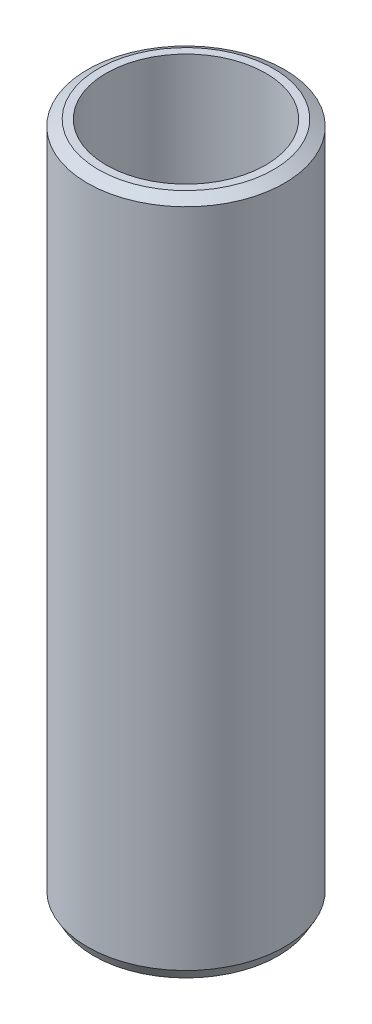
from build123d import *
from OCP.BRepFilletAPI import BRepFilletAPI_MakeChamfer

# Parameters (mm, degrees)
SKETCH1_R           = 57.5
BOSS_EXTRUDE1_DEPTH = 396.211039372
SKETCH2_R           = 46.540156531
CUT_EXTRUDE1_DEPTH  = 405.469637575
CHAMFER1_SIZE       = 3.674795118
CHAMFER1_SIZE2      = 6.364931852


with BuildPart() as part:
    # Sketch1 → Boss-Extrude1 (new body)
    with BuildSketch(Plane(origin=(0, 0, 0), x_dir=(1, 0, 0), z_dir=(0, 1, 0))):
        Circle(SKETCH1_R)
    extrude(amount=BOSS_EXTRUDE1_DEPTH)

    # Sketch2 → Cut-Extrude1 (cut, through all)
    with BuildSketch(Plane(origin=(0, 0, 0), x_dir=(1, 0, 0), z_dir=(0, 1, 0))):
        Circle(SKETCH2_R)
    extrude(amount=CUT_EXTRUDE1_DEPTH, mode=Mode.SUBTRACT)

    # Chamfer1: one chamfer whose edges measure the first distance from different faces: ONE call of the kernel's chamfer builder (chamfer() names one face for all edges)
    chamfer1_edges_1 = [part.edges().sort_by_distance(p)[0] for p in [
        (-57.5, 396.211039372, 0),
    ]]
    chamfer1_side_1 = [part.faces().sort_by_distance(p)[0] for p in [
        (-57.5, 198.105519686, 0),
    ]]
    chamfer1_edges_2 = [part.edges().sort_by_distance(p)[0] for p in [
        (-57.5, 0, 0),
    ]]
    chamfer1_side_2 = [part.faces().sort_by_distance(p)[0] for p in [
        (-55.873654403, 0, 0),
    ]]
    chamfer1 = BRepFilletAPI_MakeChamfer(part.part.solid().wrapped)
    for e in chamfer1_edges_1:
        chamfer1.Add(CHAMFER1_SIZE, CHAMFER1_SIZE2, e.wrapped, chamfer1_side_1[0].wrapped)  # the first distance lies on this face
    for e in chamfer1_edges_2:
        chamfer1.Add(CHAMFER1_SIZE, CHAMFER1_SIZE2, e.wrapped, chamfer1_side_2[0].wrapped)  # the first distance lies on this face
    add(Compound.cast(chamfer1.Shape()), mode=Mode.REPLACE)


solid = part.part
